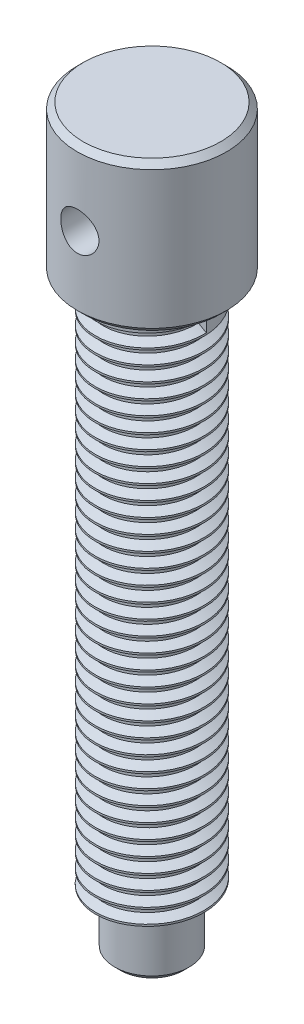
from build123d import *

# Parameters (mm, degrees)
SKETCH1_R           = 6.35
BOSS_EXTRUDE1_DEPTH = 12.7
SKETCH2_R           = 4.625
BOSS_EXTRUDE2_DEPTH = 45
SKETCH3_R           = 3.175
BOSS_EXTRUDE3_DEPTH = 5
CHAMFER1_SIZE       = 0.5
THREAD1_PITCH       = 1.25
SKETCH8_R           = 1.625
CUT_EXTRUDE1_DEPTH  = 20


with BuildPart() as part:
    # Sketch1 → Boss-Extrude1 (new body)
    with BuildSketch(Plane(origin=(0, 0, 0), x_dir=(1, 0, 0), z_dir=(0, 1, 0))):
        with Locations(Location((0, 0, 0), (0, 0, 270))):
            Circle(SKETCH1_R)
    extrude(amount=-BOSS_EXTRUDE1_DEPTH)

    # Sketch2 → Boss-Extrude2 (add)
    with BuildSketch(Plane.XZ.offset(12.7)):
        with Locations(Location((0, 0, 0), (0, 0, 90))):
            Circle(SKETCH2_R)
    extrude(amount=BOSS_EXTRUDE2_DEPTH)

    # Sketch3 → Boss-Extrude3 (add)
    with BuildSketch(Plane.XZ.offset(57.7)):
        with Locations(Location((0, 0, 0), (0, 0, 270))):
            Circle(SKETCH3_R)
    extrude(amount=BOSS_EXTRUDE3_DEPTH)

    # Chamfer1
    chamfer1_edges = [part.edges().sort_by_distance(p)[0] for p in [
        (0, -62.7, 3.175),
        (0, 0, -6.35),
        (0, -12.7, -6.35),
    ]]
    chamfer(chamfer1_edges, length=CHAMFER1_SIZE)

    # Thread1: the profile of Thread Profile1 profile screwed along a right-hand helix of 36 turns, 8 arcs to a turn; built about Z, then put on its axis
    thread1_z = Axis((0, 0, 0), (0, 0, 1))
    thread1_corners = [(4.6253, 0, -0.000173205), (4.6253, 0, 1.093923202), (3.948417656, 0, 0.703124998), (3.948417656, 0, 0.390624998)]
    with BuildLine(mode=Mode.PRIVATE) as thread1_profile:
        Line(thread1_corners[0], thread1_corners[1])
        Line(thread1_corners[1], thread1_corners[2])
        Line(thread1_corners[2], thread1_corners[3])
        Line(thread1_corners[3], thread1_corners[0])
    thread1_cap = Face(thread1_profile.wire())
    thread1_turn_angles = [0, 22.5, 45, 67.5, 90, 112.5, 135, 157.5, 180, 202.5, 225, 247.5, 270, 292.5, 315, 337.5, 360]
    thread1_turn_weights = [1, 0.9238795325112867, 1, 0.9238795325112867, 1, 0.9238795325112867, 1, 0.9238795325112867, 1, 0.9238795325112867, 1, 0.9238795325112867, 1, 0.9238795325112867, 1, 0.9238795325112867, 1]
    thread1_turn_rails = [Edge.make_bspline([Vector(p[0], p[1], 0).rotate(thread1_z, thread1_turn_angles[k]) / thread1_turn_weights[k] + Vector(0, 0, p[2] + THREAD1_PITCH * thread1_turn_angles[k] / 360) for k in range(17)], [0, 0, 0, 1, 1, 2, 2, 3, 3, 4, 4, 5, 5, 6, 6, 7, 7, 8, 8, 8], 2, thread1_turn_weights) for p in thread1_corners]
    thread1_turn_sides = [Face.make_surface_from_curves(thread1_turn_rails[p[0]], thread1_turn_rails[p[1]]) for p in [(0, 1), (1, 2), (2, 3), (3, 0)]]
    thread1 = Plane(origin=(0, -59.7, 0), x_dir=(1, 0, 0), z_dir=(0, 1, 0)) * Solid(Shell([*[p.moved(Location((0, 0, THREAD1_PITCH * i))) for i in range(36) for p in thread1_turn_sides], thread1_cap, thread1_cap.rotate(thread1_z, 12960).moved(Location((0, 0, THREAD1_PITCH * 12960 / 360)))]))
    add(thread1, mode=Mode.SUBTRACT)

    # Sketch8 → Cut-Extrude1 (cut, symmetric)
    with BuildSketch(Plane.XY):
        with Locations((0, -6.35)):
            Circle(SKETCH8_R)
    extrude(amount=CUT_EXTRUDE1_DEPTH, both=True, mode=Mode.SUBTRACT)


solid = part.part
